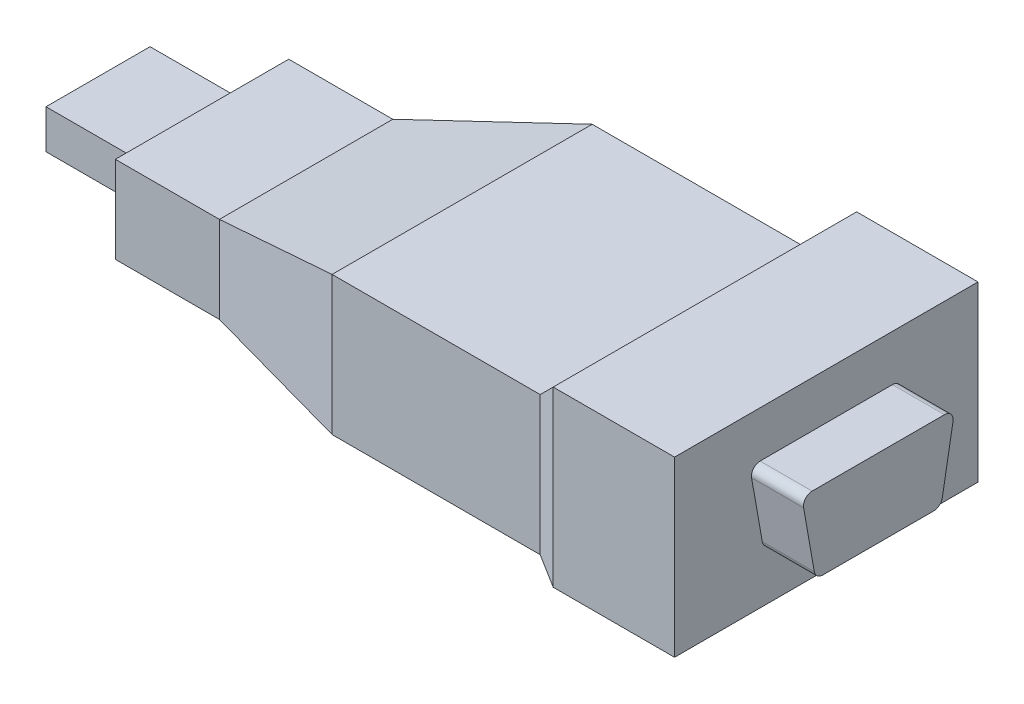
from build123d import *

# Parameters (mm, degrees)
SKETCH6_W           = 12
SKETCH6_H           = 4.5
BOSS_EXTRUDE1_DEPTH = 12
BOSS_EXTRUDE2_DEPTH = 6
SKETCH9_W           = 23
SKETCH9_H           = 6
CUT_EXTRUDE1_DEPTH  = 5


with BuildPart() as part:
    # Sketch1 → Loft1 section 0
    with BuildSketch(Plane(origin=(0, 0, 0), x_dir=(0, 0, -1), z_dir=(1, 0, 0))):
        with BuildLine():
            Line((-17.5, -5), (17.5, -5))
            Line((17.5, -5), (17.5, 15))
            Line((17.5, 15), (-17.5, 15))
            Line((-17.5, 15), (-17.5, -5))
        make_face()
    # Sketch2 → Loft1 section 1
    with BuildSketch(Plane(origin=(-14, 0, 0), x_dir=(0, 0, -1), z_dir=(1, 0, 0))):
        with BuildLine():
            Line((-17.5, -5), (17.5, -5))
            Line((17.5, -5), (17.5, 15))
            Line((17.5, 15), (-17.5, 15))
            Line((-17.5, 15), (-17.5, -5))
        make_face()
    loft()

    # Sketch2<3> → Loft2 section 0
    with BuildSketch(Plane(origin=(-14, 0, 0), x_dir=(0, 0, -1), z_dir=(1, 0, 0))):
        with BuildLine():
            Line((-17.5, -5), (17.5, -5))
            Line((17.5, -5), (17.5, 15))
            Line((17.5, 15), (-17.5, 15))
            Line((-17.5, 15), (-17.5, -5))
        make_face()
    # Sketch3 → Loft2 section 1
    with BuildSketch(Plane(origin=(-18, 0, 0), x_dir=(0, 0, -1), z_dir=(1, 0, 0))):
        with BuildLine():
            Line((-15, -5), (15, -5))
            Line((15, -5), (15, 11))
            Line((15, 11), (-15, 11))
            Line((-15, 11), (-15, -5))
        make_face()
    loft()

    # Sketch3<3> → Loft3 section 0
    with BuildSketch(Plane(origin=(-18, 0, 0), x_dir=(0, 0, -1), z_dir=(1, 0, 0))):
        with BuildLine():
            Line((-15, -5), (15, -5))
            Line((15, -5), (15, 11))
            Line((15, 11), (-15, 11))
            Line((-15, 11), (-15, -5))
        make_face()
    # Sketch4 → Loft3 section 1
    with BuildSketch(Plane(origin=(-42, 0, 0), x_dir=(0, 0, -1), z_dir=(1, 0, 0))):
        with BuildLine():
            Line((-15, -5), (15, -5))
            Line((15, -5), (15, 11))
            Line((15, 11), (-15, 11))
            Line((-15, 11), (-15, -5))
        make_face()
    loft()

    # Sketch4<3> → Loft4 section 0
    with BuildSketch(Plane(origin=(-42, 0, 0), x_dir=(0, 0, -1), z_dir=(1, 0, 0))):
        with BuildLine():
            Line((-15, -5), (15, -5))
            Line((15, -5), (15, 11))
            Line((15, 11), (-15, 11))
            Line((-15, 11), (-15, -5))
        make_face()
    # Sketch5 → Loft4 section 1
    with BuildSketch(Plane(origin=(-60, 0, 0), x_dir=(0, 0, -1), z_dir=(1, 0, 0))):
        with BuildLine():
            Line((-10, 5), (10, 5))
            Line((10, 5), (10, -5))
            Line((10, -5), (-10, -5))
            Line((-10, -5), (-10, 5))
        make_face()
    loft()

    # Sketch5<4> → Loft5 section 0
    with BuildSketch(Plane(origin=(-60, 0, 0), x_dir=(0, 0, -1), z_dir=(1, 0, 0))):
        with BuildLine():
            Line((-10, 5), (10, 5))
            Line((10, 5), (10, -5))
            Line((10, -5), (-10, -5))
            Line((-10, -5), (-10, 5))
        make_face()
    # Sketch8 → Loft5 section 1
    with BuildSketch(Plane(origin=(-72, 0, 0), x_dir=(0, 0, -1), z_dir=(1, 0, 0))):
        with BuildLine():
            Line((10, -5), (-10, -5))
            Line((-10, -5), (-10, 5))
            Line((-10, 5), (10, 5))
            Line((10, 5), (10, -5))
        make_face()
    loft()

    # Sketch6 → Boss-Extrude1 (add)
    with BuildSketch(Plane.ZY.offset(72)):
        Rectangle(SKETCH6_W, SKETCH6_H)
    extrude(amount=BOSS_EXTRUDE1_DEPTH)

    # Sketch7 → Boss-Extrude2 (add)
    with BuildSketch(Plane(origin=(0, 0, 0), x_dir=(0, 0, -1), z_dir=(1, 0, 0))):
        with BuildLine():
            Line((-7.632336679, 9.673648178), (7.632336679, 9.673648178))
            ThreePointArc((7.632336679, 9.673648178), (8.398381123, 9.316435787), (8.617144432, 8.5))
            Line((8.617144432, 8.5), (7.382855568, 1.5))
            ThreePointArc((7.382855568, 1.5), (7.040835424, 0.907603735), (6.398047815, 0.673648178))
            Line((6.398047815, 0.673648178), (-6.398047815, 0.673648178))
            ThreePointArc((-6.398047815, 0.673648178), (-7.040835424, 0.907603735), (-7.382855568, 1.5))
            Line((-7.382855568, 1.5), (-8.617144432, 8.5))
            ThreePointArc((-8.617144432, 8.5), (-8.398381123, 9.316435787), (-7.632336679, 9.673648178))
        make_face()
    extrude(amount=BOSS_EXTRUDE2_DEPTH)

    # Sketch9 → Cut-Extrude1 (cut)
    with BuildSketch(Plane(origin=(0, 0, -15), x_dir=(-1, 0, 0), z_dir=(0, 0, -1))):
        with Locations((29.5, 3)):
            Rectangle(SKETCH9_W, SKETCH9_H)
    extrude(amount=-CUT_EXTRUDE1_DEPTH, mode=Mode.SUBTRACT)


solid = part.part
